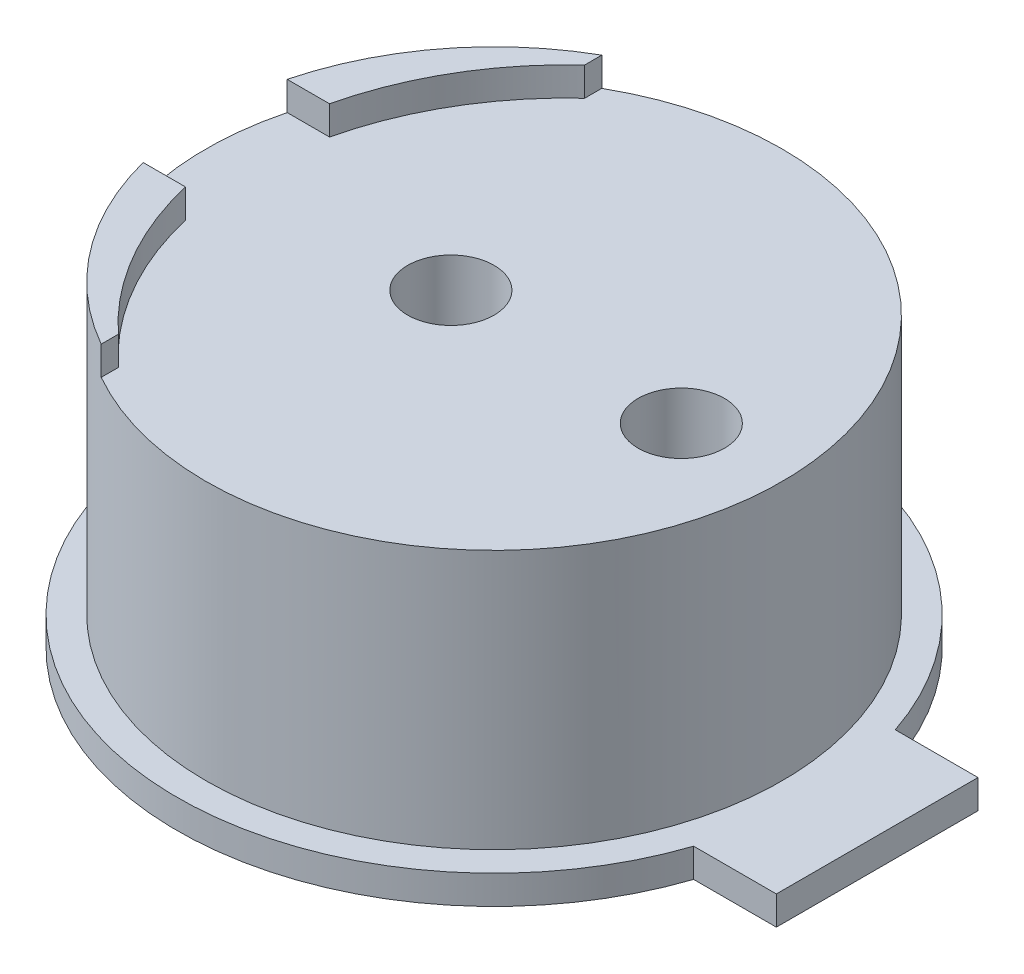
from build123d import *

# Parameters (mm, degrees)
STOCK_ECCENTRIC_START               = 21
STOCK_ECCENTRIC_SHAFT_1_OUTLINE_R   = 10
STOCK_ECCENTRIC_SHAFT_1_OUTLINE_R_2 = 1.5
STOCK_ECCENTRIC_SHAFT_1_DEPTH       = 9
STOCK_ECCENTRIC_START_2             = 30
STOCK_ECCENTRIC_SHAFT_1_2_DEPTH     = 1
BOSS_EXTRUDE1_START                 = 1
SKETCH1_R                           = 10
SKETCH1_R_2                         = 1.5
BOSS_EXTRUDE1_DEPTH                 = 1
CUT_EXTRUDE1_START                  = -1
CUT_EXTRUDE1_DEPTH                  = 1


# Read off the part's stored shape, not the designer's step: Stock-Eccentric Shaft-1
with BuildPart() as part:
    # Stock-Eccentric Shaft-1 outline → Stock-Eccentric Shaft-1 (new body)
    with BuildSketch(Plane(origin=(0, 0, 0), x_dir=(1, 0, 0), z_dir=(0, 1, 0)).offset(STOCK_ECCENTRIC_START)):
        with Locations((-2.5, 0)):
            Circle(STOCK_ECCENTRIC_SHAFT_1_OUTLINE_R)
        with Locations((-4, 0)):
            Circle(STOCK_ECCENTRIC_SHAFT_1_OUTLINE_R_2, mode=Mode.SUBTRACT)
        with Locations((4, 0)):
            Circle(STOCK_ECCENTRIC_SHAFT_1_OUTLINE_R_2, mode=Mode.SUBTRACT)
    extrude(amount=STOCK_ECCENTRIC_SHAFT_1_DEPTH)

    # Stock-Eccentric Shaft-1 2 outline → Stock-Eccentric Shaft-1 2 (add)
    with BuildSketch(Plane(origin=(0, 0, 0), x_dir=(1, 0, 0), z_dir=(0, 1, 0)).offset(STOCK_ECCENTRIC_START_2)):
        with BuildLine():
            ThreePointArc((-10.712142643, 2.5), (-8.817418729, 6.576710953), (-5.45, 9.554972527))
            ThreePointArc((-5.45, 9.554972527), (-9.734494483, 6.903773575), (-12.182458366, 2.5))
            Line((-12.182458366, 2.5), (-10.712142643, 2.5))
        make_face()
        with BuildLine():
            ThreePointArc((-12.182458366, -2.5), (-9.734494483, -6.903773575), (-5.45, -9.554972527))
            ThreePointArc((-5.45, -9.554972527), (-8.817418729, -6.576710953), (-10.712142643, -2.5))
            Line((-10.712142643, -2.5), (-12.182458366, -2.5))
        make_face()
    extrude(amount=STOCK_ECCENTRIC_SHAFT_1_2_DEPTH)

    # Sketch1 → Boss-Extrude1 (add)
    # profile 1 of 4: a face of its own
    with BuildSketch(Plane.XZ.offset(-21).offset(BOSS_EXTRUDE1_START)):
        with BuildLine():
            Line((7.928326807, -3.5), (7.8, -3.5))
            Line((7.8, -3.5), (7.8, 3.5))
            Line((7.8, 3.5), (7.928326807, 3.5))
            ThreePointArc((7.928326807, 3.5), (-13.5, 0), (7.928326807, -3.5))
        make_face()
        with Locations(Location((-2.5, 0, 0), (0, 0, 252.842462628))):
            Circle(SKETCH1_R, mode=Mode.SUBTRACT)
    # profile 2 of 4: a face of its own
    with BuildSketch(Plane.XZ.offset(-21).offset(BOSS_EXTRUDE1_START)):
        with Locations(Location((-2.5, 0, 0), (0, 0, 252.842462628))):
            Circle(SKETCH1_R)
        with Locations(Location((4, 0, 0), (0, 0, 90))):
            Circle(SKETCH1_R_2, mode=Mode.SUBTRACT)
        with Locations(Location((-4, 0, 0), (0, 0, 90))):
            Circle(SKETCH1_R_2, mode=Mode.SUBTRACT)
    # profile 3 of 4: a face of its own
    with BuildSketch(Plane.XZ.offset(-21).offset(BOSS_EXTRUDE1_START)):
        with BuildLine():
            Line((7.8, 3.5), (7.8, -3.5))
            Line((7.8, -3.5), (7.928326807, -3.5))
            ThreePointArc((7.928326807, -3.5), (8.356141001, -1.773189939), (8.5, 0))
            ThreePointArc((8.5, 0), (8.356141001, 1.773189939), (7.928326807, 3.5))
            Line((7.928326807, 3.5), (7.8, 3.5))
        make_face()
    # profile 4 of 4: a face of its own
    with BuildSketch(Plane.XZ.offset(-21).offset(BOSS_EXTRUDE1_START)):
        with BuildLine():
            ThreePointArc((8.5, 0), (8.356141001, -1.773189939), (7.928326807, -3.5))
            Line((7.928326807, -3.5), (10.8, -3.5))
            Line((10.8, -3.5), (10.8, 3.5))
            Line((10.8, 3.5), (7.928326807, 3.5))
            ThreePointArc((7.928326807, 3.5), (8.356141001, 1.773189939), (8.5, 0))
        make_face()
    extrude(amount=-BOSS_EXTRUDE1_DEPTH)

    # Sketch2 → Cut-Extrude1 (cut)
    with BuildSketch(Plane(origin=(0, 31, 0), x_dir=(1, 0, 0), z_dir=(0, 1, 0)).offset(CUT_EXTRUDE1_START)):
        with BuildLine():
            ThreePointArc((-5.45, 9.554972527), (-6.473664245, 9.176600268), (-7.45, 8.688929738))
            Line((-7.45, 8.688929738), (-7.45, 8.093052576))
            ThreePointArc((-7.45, 8.093052576), (-6.491286659, 8.880495342), (-5.45, 9.554972527))
        make_face()
        with BuildLine():
            ThreePointArc((-5.45, -9.554972527), (-6.491286659, -8.880495342), (-7.45, -8.093052576))
            Line((-7.45, -8.093052576), (-7.45, -8.688929738))
            ThreePointArc((-7.45, -8.688929738), (-6.473664245, -9.176600268), (-5.45, -9.554972527))
        make_face()
    extrude(amount=CUT_EXTRUDE1_DEPTH, mode=Mode.SUBTRACT)


solid = part.part
